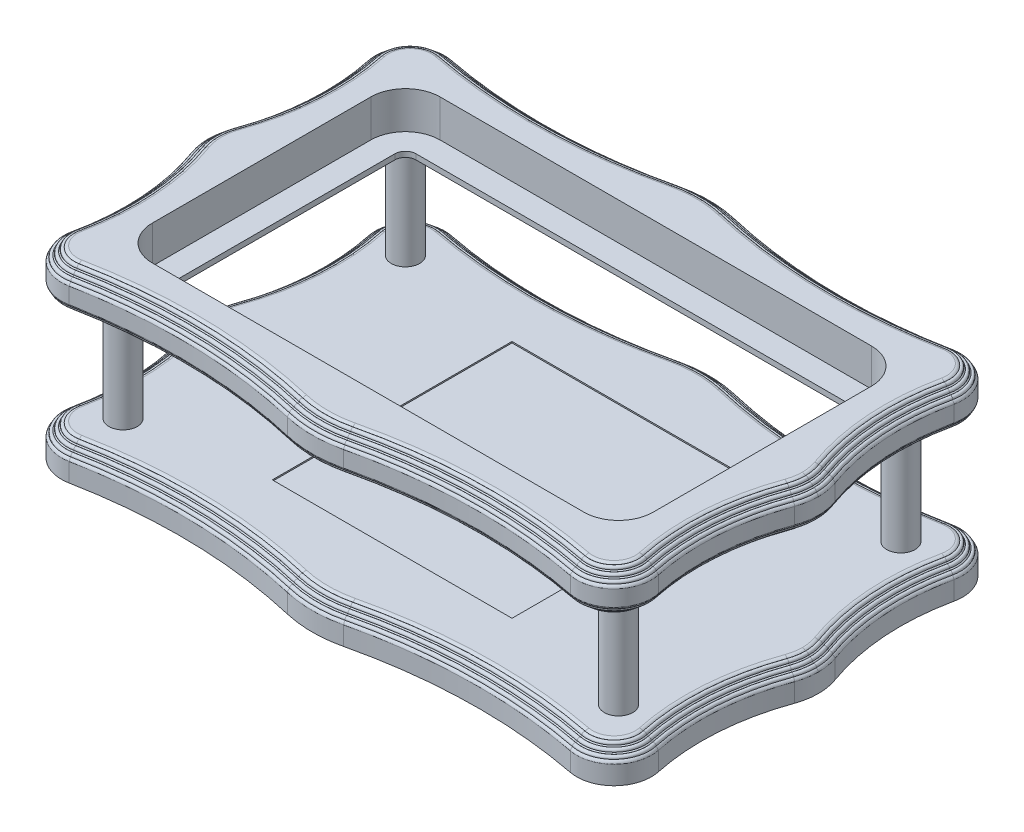
from build123d import *

# Parameters (mm, degrees)
SKETCH1_W              = 115
SKETCH1_H              = 75
BASE_DEPTH             = 6
SKETCH4_R              = 2.666666667
SUPPORT_POSTS_DEPTH    = 20.5
SKETCH5_W              = 45
SKETCH5_H              = 45
PYRAMID_BASE_CUT_DEPTH = 0.25
SKETCH6_W              = 115
SKETCH6_H              = 75
BOSS_EXTRUDE2_DEPTH    = 8
SCREEN_SIZE_CUT_DEPTH  = 8
DEVICE_SHAPE_CUT_DEPTH = 7


with BuildPart() as part:
    # Sketch1 → Base (new body)
    with BuildSketch(Plane(origin=(0, 0, 0), x_dir=(1, 0, 0), z_dir=(0, 1, 0))):
        Rectangle(SKETCH1_W, SKETCH1_H)
    extrude(amount=BASE_DEPTH)

    # Sweep Cut: sweep along a path in Path
    with BuildLine(Plane(origin=(0, 6, 0), x_dir=(1, 0, 0), z_dir=(0, 1, 0))) as sweep_cut_path:
        ThreePointArc((4.590909091, 33.967813339), (0, 34.5), (-4.590909091, 33.967813339))
        ThreePointArc((-4.590909091, 33.967813339), (-26.049498342, 31.269257036), (-47.596562859, 33.134000848))
        ThreePointArc((-47.596562859, 33.134000848), (-51.212709806, 32.011484521), (-52.272742782, 28.376530361))
        ThreePointArc((-52.272742782, 28.376530361), (-51.358336789, 15.452972347), (-54.016508134, 2.772727273))
        ThreePointArc((-54.016508134, 2.772727273), (-54.5, 0), (-54.016508134, -2.772727273))
        ThreePointArc((-54.016508134, -2.772727273), (-51.358336789, -15.452972347), (-52.272742782, -28.376530361))
        ThreePointArc((-52.272742782, -28.376530361), (-51.212709806, -32.011484521), (-47.596562859, -33.134000848))
        ThreePointArc((-47.596562859, -33.134000848), (-26.049498342, -31.269257036), (-4.590909091, -33.967813339))
        ThreePointArc((-4.590909091, -33.967813339), (0, -34.5), (4.590909091, -33.967813339))
        ThreePointArc((4.590909091, -33.967813339), (26.049498342, -31.269257036), (47.596562859, -33.134000848))
        ThreePointArc((47.596562859, -33.134000848), (51.212709806, -32.011484521), (52.272742782, -28.376530361))
        ThreePointArc((52.272742782, -28.376530361), (51.358336789, -15.452972347), (54.016508134, -2.772727273))
        ThreePointArc((54.016508134, -2.772727273), (54.5, 0), (54.016508134, 2.772727273))
        ThreePointArc((54.016508134, 2.772727273), (51.358336789, 15.452972347), (52.272742782, 28.376530361))
        ThreePointArc((52.272742782, 28.376530361), (51.212709806, 32.011484521), (47.596562859, 33.134000848))
        ThreePointArc((47.596562859, 33.134000848), (26.049498342, 31.269257036), (4.590909091, 33.967813339))
    # Profile → Sweep Cut (sweep, cut)
    with BuildSketch(Plane.XY):
        with BuildLine():
            Line((54.5, 6), (57.5, 6))
            Line((57.5, 6), (67.5, 8))
            Line((67.5, 8), (67.5, 3.5))
            Line((67.5, 3.5), (67.5, -4.5))
            Line((67.5, -4.5), (57.5, -4.5))
            Line((57.5, -4.5), (57.5, 3.5))
            ThreePointArc((57.5, 3.5), (57.371711227, 3.803953735), (57.12703102, 4.025262295))
            ThreePointArc((57.12703102, 4.025262295), (56.999671916, 4.424606299), (56.583908139, 4.477864696))
            ThreePointArc((56.583908139, 4.477864696), (56.488140605, 4.573268726), (56.37703102, 4.650262295))
            ThreePointArc((56.37703102, 4.650262295), (56.249671916, 5.049606299), (55.833908139, 5.102864696))
            ThreePointArc((55.833908139, 5.102864696), (55.738140605, 5.198268726), (55.62703102, 5.275262295))
            ThreePointArc((55.62703102, 5.275262295), (55.499671916, 5.674606299), (55.083908139, 5.727864696))
            ThreePointArc((55.083908139, 5.727864696), (54.822104928, 5.928625651), (54.5, 6))
        make_face()
    sweep(path=sweep_cut_path.line, mode=Mode.SUBTRACT)

    # Sketch4 → Support Posts (add)
    with BuildSketch(Plane(origin=(0, 6, 0), x_dir=(1, 0, 0), z_dir=(0, 1, 0))):
        with Locations(Location((-46.5, -26.5, 0), (0, 0, 270))):
            Circle(SKETCH4_R)
        with Locations(Location((46.5, -26.5, 0), (0, 0, 270))):
            Circle(SKETCH4_R)
        with Locations(Location((46.5, 26.5, 0), (0, 0, 270))):
            Circle(SKETCH4_R)
        with Locations(Location((-46.5, 26.5, 0), (0, 0, 270))):
            Circle(SKETCH4_R)
    extrude(amount=SUPPORT_POSTS_DEPTH)

    # Sketch5 → Pyramid Base Cut (cut)
    with BuildSketch(Plane(origin=(0, 6, 0), x_dir=(1, 0, 0), z_dir=(0, 1, 0))):
        Rectangle(SKETCH5_W, SKETCH5_H)
    extrude(amount=-PYRAMID_BASE_CUT_DEPTH, mode=Mode.SUBTRACT)

    # Sketch6 → Boss-Extrude2 (add)
    with BuildSketch(Plane(origin=(0, 26.5, 0), x_dir=(1, 0, 0), z_dir=(0, 1, 0))):
        Rectangle(SKETCH6_W, SKETCH6_H)
    extrude(amount=BOSS_EXTRUDE2_DEPTH)

    # Sweep Cut 2: sweep along a path in Path 2
    with BuildLine(Plane.XZ.offset(-26.5)) as sweep_cut_2_path:
        ThreePointArc((52.272742782, 28.376530361), (51.358336789, 15.452972347), (54.016508134, 2.772727273))
        ThreePointArc((54.016508134, 2.772727273), (54.5, 0), (54.016508134, -2.772727273))
        ThreePointArc((54.016508134, -2.772727273), (51.358336789, -15.452972347), (52.272742782, -28.376530361))
        ThreePointArc((52.272742782, -28.376530361), (51.212709806, -32.011484521), (47.596562859, -33.134000848))
        ThreePointArc((47.596562859, -33.134000848), (26.049498342, -31.269257036), (4.590909091, -33.967813339))
        ThreePointArc((4.590909091, -33.967813339), (0, -34.5), (-4.590909091, -33.967813339))
        ThreePointArc((-4.590909091, -33.967813339), (-26.049498342, -31.269257036), (-47.596562859, -33.134000848))
        ThreePointArc((-47.596562859, -33.134000848), (-51.212709806, -32.011484521), (-52.272742782, -28.376530361))
        ThreePointArc((-52.272742782, -28.376530361), (-51.358336789, -15.452972347), (-54.016508134, -2.772727273))
        ThreePointArc((-54.016508134, -2.772727273), (-54.5, 0), (-54.016508134, 2.772727273))
        ThreePointArc((-54.016508134, 2.772727273), (-51.358336789, 15.452972347), (-52.272742782, 28.376530361))
        ThreePointArc((-52.272742782, 28.376530361), (-51.212709806, 32.011484521), (-47.596562859, 33.134000848))
        ThreePointArc((-47.596562859, 33.134000848), (-26.049498342, 31.269257036), (-4.590909091, 33.967813339))
        ThreePointArc((-4.590909091, 33.967813339), (0, 34.5), (4.590909091, 33.967813339))
        ThreePointArc((4.590909091, 33.967813339), (26.049498342, 31.269257036), (47.596562859, 33.134000848))
        ThreePointArc((47.596562859, 33.134000848), (51.212709806, 32.011484521), (52.272742782, 28.376530361))
    # Profile 2 → Sweep Cut 2 (sweep, cut)
    with BuildSketch(Plane.XY):
        with BuildLine():
            Line((54.5, 34.5), (57.5, 34.5))
            Line((57.5, 34.5), (67.5, 34.5))
            Line((67.5, 34.5), (67.5, 32))
            Line((67.5, 32), (67.5, 29))
            Line((67.5, 29), (67.5, 26.5))
            Line((67.5, 26.5), (57.5, 26.5))
            Line((57.5, 26.5), (54.5, 26.5))
            ThreePointArc((54.5, 26.5), (54.822104928, 26.571374349), (55.083908139, 26.772135304))
            ThreePointArc((55.083908139, 26.772135304), (55.499671916, 26.825393701), (55.62703102, 27.224737705))
            ThreePointArc((55.62703102, 27.224737705), (55.738140605, 27.301731274), (55.833908139, 27.397135304))
            ThreePointArc((55.833908139, 27.397135304), (56.249671916, 27.450393701), (56.37703102, 27.849737705))
            ThreePointArc((56.37703102, 27.849737705), (56.488140605, 27.926731274), (56.583908139, 28.022135304))
            ThreePointArc((56.583908139, 28.022135304), (56.999671916, 28.075393701), (57.12703102, 28.474737705))
            ThreePointArc((57.12703102, 28.474737705), (57.371711227, 28.696046265), (57.5, 29))
            Line((57.5, 29), (57.5, 32))
            ThreePointArc((57.5, 32), (57.371711227, 32.303953735), (57.12703102, 32.525262295))
            ThreePointArc((57.12703102, 32.525262295), (56.999671916, 32.924606299), (56.583908139, 32.977864696))
            ThreePointArc((56.583908139, 32.977864696), (56.488140605, 33.073268726), (56.37703102, 33.150262295))
            ThreePointArc((56.37703102, 33.150262295), (56.249671916, 33.549606299), (55.833908139, 33.602864696))
            ThreePointArc((55.833908139, 33.602864696), (55.738140605, 33.698268726), (55.62703102, 33.775262295))
            ThreePointArc((55.62703102, 33.775262295), (55.499671916, 34.174606299), (55.083908139, 34.227864696))
            ThreePointArc((55.083908139, 34.227864696), (54.822104928, 34.428625651), (54.5, 34.5))
        make_face()
    sweep(path=sweep_cut_2_path.line, mode=Mode.SUBTRACT)

    # Sketch10 → Screen Size Cut (cut)
    with BuildSketch(Plane(origin=(0, 34.5, 0), x_dir=(1, 0, 0), z_dir=(0, 1, 0))):
        with BuildLine():
            Line((40.5, -22.5), (-40.5, -22.5))
            ThreePointArc((-40.5, -22.5), (-41.914213562, -21.914213562), (-42.5, -20.5))
            Line((-42.5, -20.5), (-42.5, 20.5))
            ThreePointArc((-42.5, 20.5), (-41.914213562, 21.914213562), (-40.5, 22.5))
            Line((-40.5, 22.5), (40.5, 22.5))
            ThreePointArc((40.5, 22.5), (41.914213562, 21.914213562), (42.5, 20.5))
            Line((42.5, 20.5), (42.5, -20.5))
            ThreePointArc((42.5, -20.5), (41.914213562, -21.914213562), (40.5, -22.5))
        make_face()
    extrude(amount=-SCREEN_SIZE_CUT_DEPTH, mode=Mode.SUBTRACT)

    # Sketch12 → Device Shape Cut (cut)
    with BuildSketch(Plane(origin=(0, 34.5, 0), x_dir=(1, 0, 0), z_dir=(0, 1, 0))):
        with BuildLine():
            Line((47, -20.5), (47, 20.5))
            ThreePointArc((47, 20.5), (45.096194078, 25.096194078), (40.5, 27))
            Line((40.5, 27), (-40.5, 27))
            ThreePointArc((-40.5, 27), (-45.096194078, 25.096194078), (-47, 20.5))
            Line((-47, 20.5), (-47, -20.5))
            ThreePointArc((-47, -20.5), (-45.096194078, -25.096194078), (-40.5, -27))
            Line((-40.5, -27), (40.5, -27))
            ThreePointArc((40.5, -27), (45.096194078, -25.096194078), (47, -20.5))
        make_face()
    extrude(amount=-DEVICE_SHAPE_CUT_DEPTH, mode=Mode.SUBTRACT)


solid = part.part
